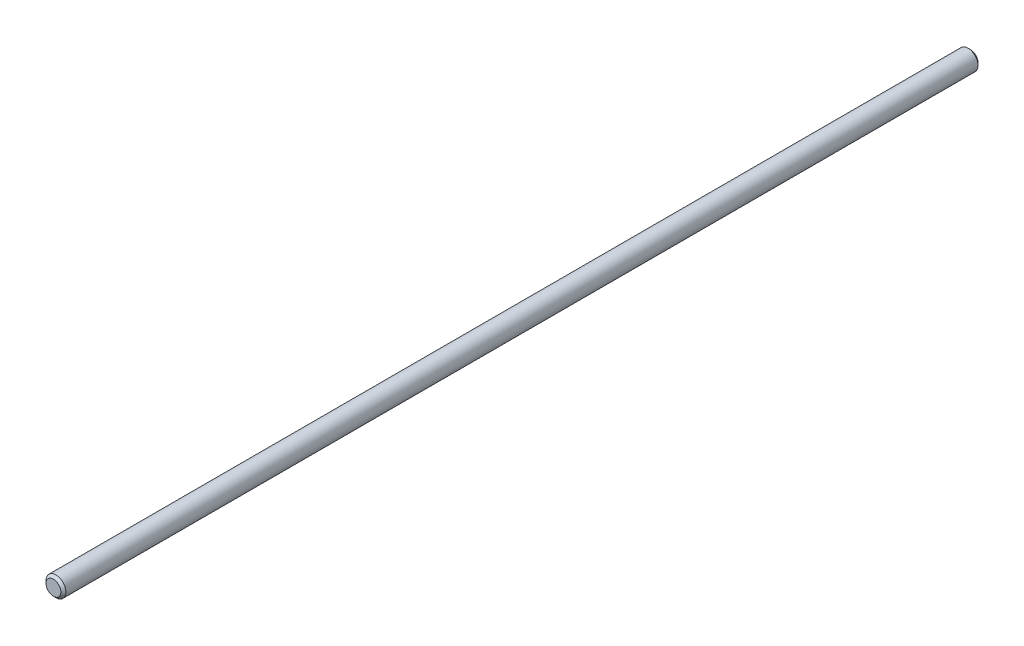
from build123d import *

# Parameters (mm, degrees)
SCHIZZO1_R                   = 4
ESTRUSIONE_ESTRUSIONE1_DEPTH = 370
SMUSSO1_SIZE                 = 1


with BuildPart() as part:
    # Schizzo1 → Estrusione-Estrusione1 (new body)
    with BuildSketch(Plane.XY):
        Circle(SCHIZZO1_R)
    extrude(amount=ESTRUSIONE_ESTRUSIONE1_DEPTH)

    # Smusso1
    smusso1_edges = [part.edges().sort_by_distance(p)[0] for p in [
        (-4, 0, 370),
        (-4, 0, 0),
    ]]
    chamfer(smusso1_edges, length=SMUSSO1_SIZE)


solid = part.part
